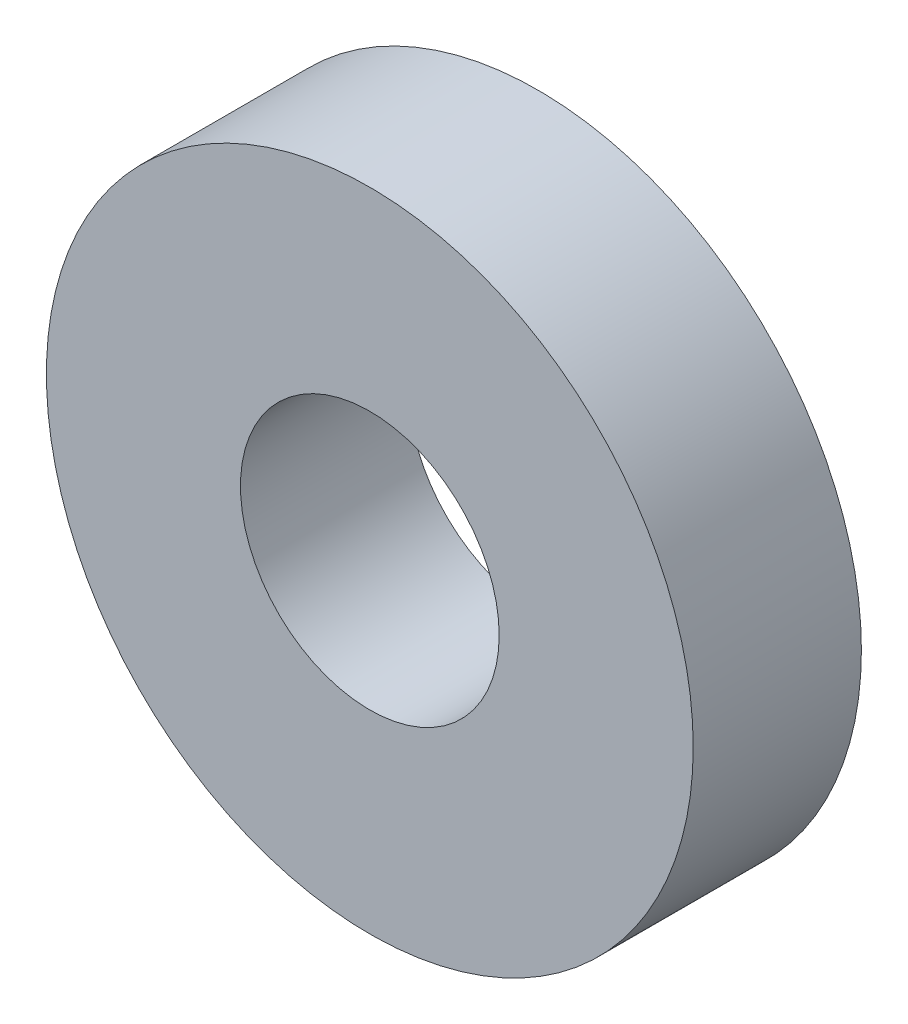
from build123d import *

# Parameters (mm, degrees)
SKETCH1_R               = 7.5
BOSS_EXTRUDE1_DEPTH     = 3.9
CUT_EXTRUDE4_DEPTH      = 10
CUT_EXTRUDE4_DEPTH_BACK = 12.300884921
SKETCH1_7_R             = 3


with BuildPart() as part:
    # Sketch1 → Boss-Extrude1 (new body)
    with BuildSketch(Plane.XY):
        Circle(SKETCH1_R)
    extrude(amount=BOSS_EXTRUDE1_DEPTH)

    # Sketch1<7> → Cut-Extrude4 (cut, two sides: drawn at the far end of the back side and taken through both)
    with BuildSketch(Plane.XY.offset(-CUT_EXTRUDE4_DEPTH_BACK)):
        Circle(SKETCH1_7_R)
    extrude(amount=CUT_EXTRUDE4_DEPTH + CUT_EXTRUDE4_DEPTH_BACK, mode=Mode.SUBTRACT)


solid = part.part
